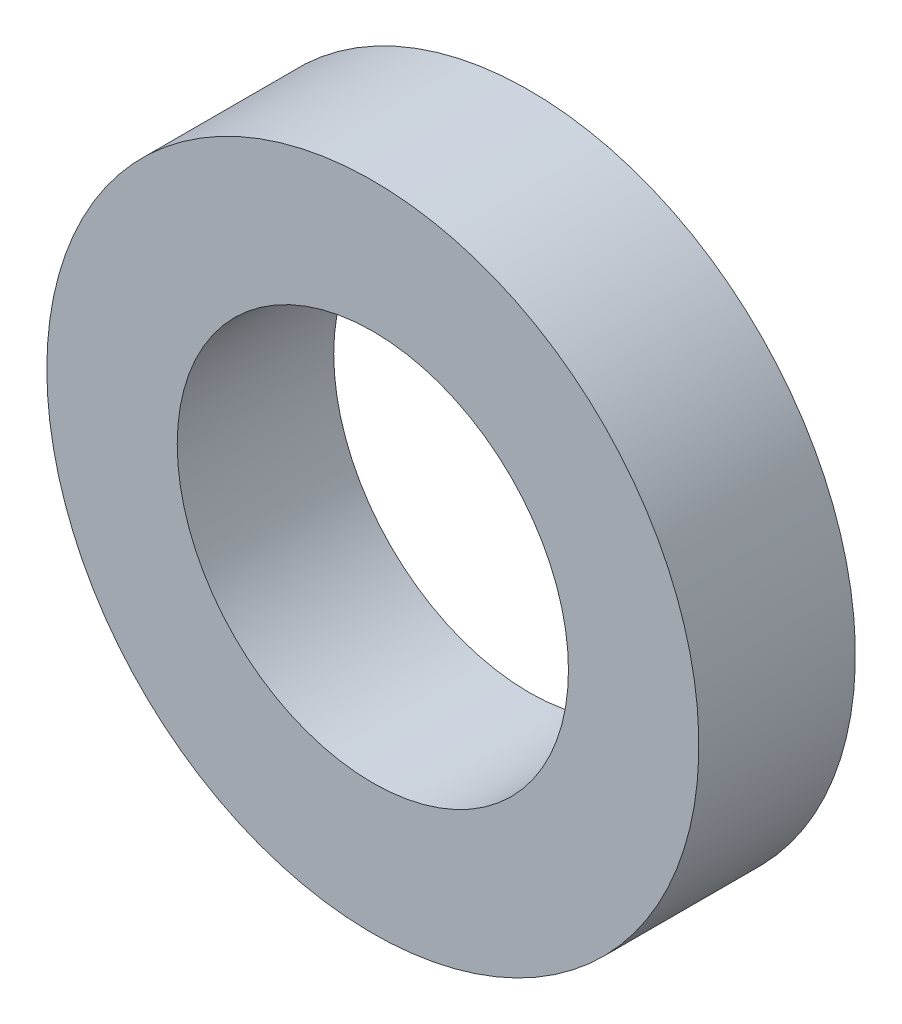
from build123d import *

# Parameters (mm, degrees)
SKETCH1_R           = 15.875
SKETCH1_R_2         = 9.525
BOSS_EXTRUDE1_DEPTH = 7.62


with BuildPart() as part:
    # Sketch1 → Boss-Extrude1 (new body)
    with BuildSketch(Plane.XY):
        Circle(SKETCH1_R)
        Circle(SKETCH1_R_2, mode=Mode.SUBTRACT)
    extrude(amount=BOSS_EXTRUDE1_DEPTH)


solid = part.part
